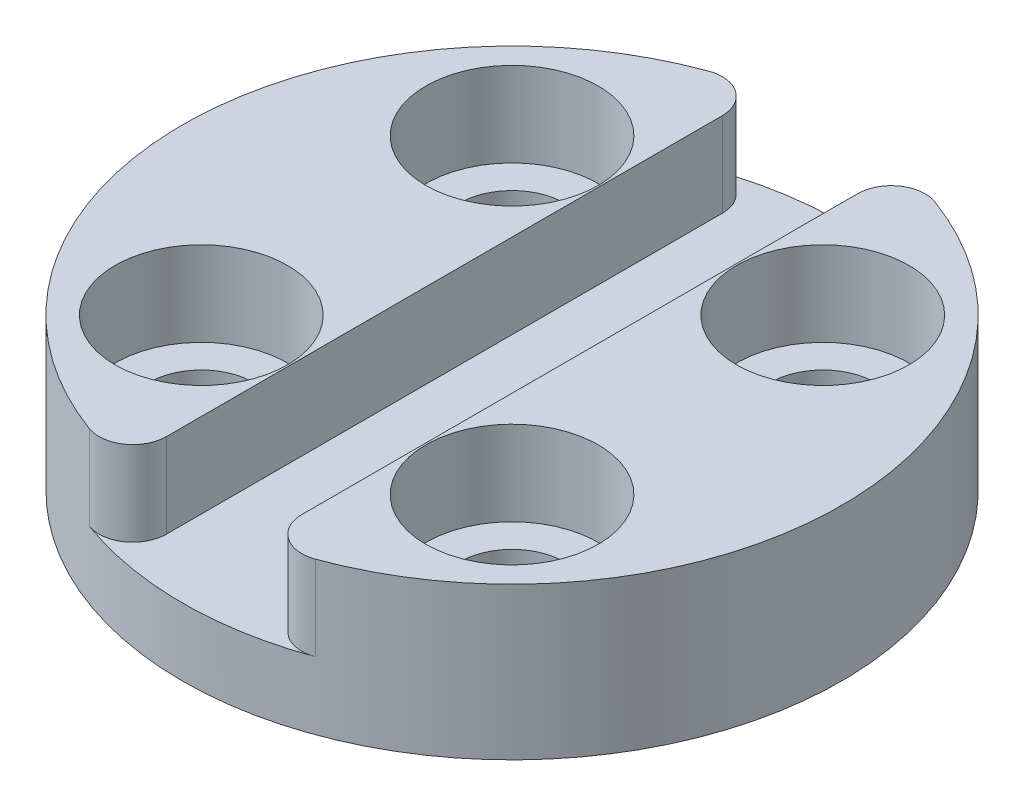
from build123d import *
from build123d.topology import SkipClean

# Parameters (mm, degrees)
SKETCH_1_R      = 9.75
SKETCH_1_R_2    = 1.55
EXTRUDE_1_DEPTH = 2
SKETCH_2_R      = 2.55
EXTRUDE_2_DEPTH = 2.5


with BuildPart() as part:
    # 草图1 → 凸台-拉伸1 (new body)
    with BuildSketch(Plane(origin=(0, 0, 0), x_dir=(1, 0, 0), z_dir=(0, 1, 0))):
        Circle(SKETCH_1_R)
        with Locations((4.596194078, 4.596194078)):
            Circle(SKETCH_1_R_2, mode=Mode.SUBTRACT)
        with Locations((4.596194078, -4.596194078)):
            Circle(SKETCH_1_R_2, mode=Mode.SUBTRACT)
        with Locations((-4.596194078, -4.596194078)):
            Circle(SKETCH_1_R_2, mode=Mode.SUBTRACT)
        with Locations((-4.596194078, 4.596194078)):
            Circle(SKETCH_1_R_2, mode=Mode.SUBTRACT)
    extrude(amount=EXTRUDE_1_DEPTH)

    # 草图2 → 凸台-拉伸2 (add)
    # profile 1 of 2: a face of its own
    with SkipClean():  # the faces are left unmerged after this step: merging them gives an invalid solid
        with BuildSketch(Plane(origin=(0, 2, 0), x_dir=(1, 0, 0), z_dir=(0, 1, 0))):
            with BuildLine():
                Line((-2, 8.219641111), (-2, -8.219641111))
                ThreePointArc((-2, -8.219641111), (-2.426788496, -9.039048563), (-3.342857143, -9.159028667))
                ThreePointArc((-3.342857143, -9.159028667), (-9.75, 0), (-3.342857143, 9.159028667))
                ThreePointArc((-3.342857143, 9.159028667), (-2.426788496, 9.039048563), (-2, 8.219641111))
            make_face()
            with Locations((-4.596194078, 4.596194078)):
                Circle(SKETCH_2_R, mode=Mode.SUBTRACT)
            with Locations((-4.596194078, -4.596194078)):
                Circle(SKETCH_2_R, mode=Mode.SUBTRACT)
        # profile 2 of 2: a face of its own
        with BuildSketch(Plane(origin=(0, 2, 0), x_dir=(1, 0, 0), z_dir=(0, 1, 0))):
            with BuildLine():
                Line((2, 8.219641111), (2, -8.219641111))
                ThreePointArc((2, -8.219641111), (2.426788496, -9.039048563), (3.342857143, -9.159028667))
                ThreePointArc((3.342857143, -9.159028667), (9.75, 0), (3.342857143, 9.159028667))
                ThreePointArc((3.342857143, 9.159028667), (2.426788496, 9.039048563), (2, 8.219641111))
            make_face()
            with Locations((4.596194078, 4.596194078)):
                Circle(SKETCH_2_R, mode=Mode.SUBTRACT)
            with Locations((4.596194078, -4.596194078)):
                Circle(SKETCH_2_R, mode=Mode.SUBTRACT)
        extrude(amount=EXTRUDE_2_DEPTH)


solid = part.part
